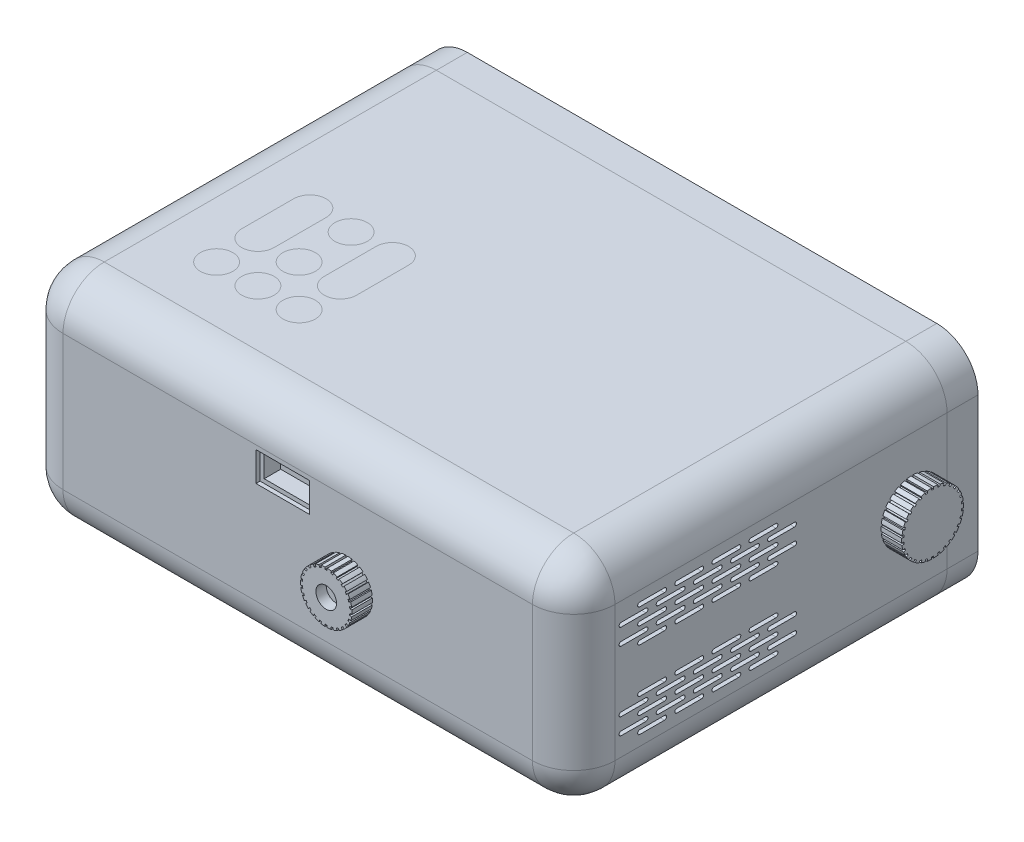
from build123d import *

# Parameters (mm, degrees)
SKETCH1_W               = 169.926
SKETCH1_H               = 124.46
BOSS_EXTRUDE1_DEPTH     = 67.056
FILLET1_R               = 12.7
SKETCH2_R               = 9.525
BOSS_EXTRUDE2_DEPTH     = 6.35
CUT_EXTRUDE1_DEPTH      = 6.35
SKETCH5_R               = 7.9375
BOSS_EXTRUDE3_DEPTH     = 6.35
SKETCH6_R               = 3.175
CUT_EXTRUDE3_DEPTH      = 3.175
CUT_EXTRUDE4_DEPTH      = 174.048626706
CUT_EXTRUDE4_DEPTH_BACK = 6.35
SKETCH8_R               = 4.445
CUT_EXTRUDE5_DEPTH      = 6.35
FILLET2_R               = 1
CUT_EXTRUDE6_DEPTH      = 6.35
CUT_EXTRUDE7_DEPTH      = 9.525
BOSS_EXTRUDE4_DEPTH     = 9.525
BOSS_EXTRUDE5_DEPTH     = 9.525
SKETCH13_3_R            = 25.4
BOSS_EXTRUDE6_DEPTH     = 9.525
FILLET3_R               = 1
BOSS_EXTRUDE7_DEPTH     = 9.525
SKETCH15_R              = 22.225
SKETCH15_R_2            = 18.415
BOSS_EXTRUDE8_DEPTH     = 3.81
CHAMFER1_SIZE           = 1.27
SKETCH15_3_R            = 18.415
SKETCH15_3_R_2          = 13.335
BOSS_EXTRUDE9_DEPTH     = 2.54
SKETCH16_R              = 6.35
SKETCH16_R_2            = 5.08
BOSS_EXTRUDE10_DEPTH    = 2.54
SKETCH17_R              = 5.08
BOSS_EXTRUDE11_DEPTH    = 5.08
BOSS_EXTRUDE11_2_DEPTH  = 5.08
BOSS_EXTRUDE11_3_DEPTH  = 5.08
BOSS_EXTRUDE11_4_DEPTH  = 5.08
CUT_EXTRUDE8_START      = 5.08
SKETCH18_R              = 5.715
SKETCH18_R_2            = 4.445
CUT_EXTRUDE8_DEPTH      = 1.27
SKETCH19_R              = 5
CUT_EXTRUDE9_DEPTH      = 2.54
SKETCH20_R              = 5
BOSS_EXTRUDE12_DEPTH    = 2.54
BOSS_EXTRUDE12_2_DEPTH  = 2.54
BOSS_EXTRUDE12_3_DEPTH  = 2.54
BOSS_EXTRUDE12_4_DEPTH  = 2.54
BOSS_EXTRUDE12_5_DEPTH  = 2.54
BOSS_EXTRUDE12_6_DEPTH  = 2.54
BOSS_EXTRUDE12_7_DEPTH  = 2.54
SKETCH21_W              = 14
SKETCH21_H              = 6.5
CUT_EXTRUDE10_DEPTH     = 6.35
SKETCH22_W              = 16.54
SKETCH22_H              = 9.04
SKETCH22_W_2            = 14
SKETCH22_H_2            = 6.5
CUT_EXTRUDE11_DEPTH     = 1.27
SKETCH23_R              = 15.875
CUT_EXTRUDE12_DEPTH     = 1.5875
SKETCH23_2_R            = 15.875
BOSS_EXTRUDE13_DEPTH    = 1.5875


with BuildPart() as part:
    # Sketch1 → Boss-Extrude1 (new body)
    with BuildSketch(Plane(origin=(0, 0, 0), x_dir=(1, 0, 0), z_dir=(0, 1, 0))):
        Rectangle(SKETCH1_W, SKETCH1_H)
    extrude(amount=BOSS_EXTRUDE1_DEPTH)

    # Fillet1
    fillet1_edges = [part.edges().sort_by_distance(p)[0] for p in [
        (-84.963, 67.056, 0),
        (0, 67.056, 62.23),
        (84.963, 67.056, 0),
        (0, 0, 62.23),
        (-84.963, 0, 0),
        (84.963, 0, 0),
        (84.963, 33.528, 62.23),
        (-84.963, 33.528, 62.23),
    ]]
    fillet(fillet1_edges, radius=FILLET1_R)

    # Sketch3 → Cut-Extrude1 (cut)
    with BuildSketch(Plane(origin=(84.963, 0, 0), x_dir=(0, 0, -1), z_dir=(1, 0, 0))):
        with BuildLine():
            Line((-41.91, 51.181), (-34.29, 51.181))
            ThreePointArc((-34.29, 51.181), (-33.655, 50.546), (-34.29, 49.911))
            Line((-34.29, 49.911), (-41.91, 49.911))
            ThreePointArc((-41.91, 49.911), (-42.545, 50.546), (-41.91, 51.181))
        make_face()
        with BuildLine():
            Line((-30.48, 51.181), (-22.86, 51.181))
            ThreePointArc((-22.86, 51.181), (-22.225, 50.546), (-22.86, 49.911))
            Line((-22.86, 49.911), (-30.48, 49.911))
            ThreePointArc((-30.48, 49.911), (-31.115, 50.546), (-30.48, 51.181))
        make_face()
        with BuildLine():
            Line((-19.05, 51.181), (-11.43, 51.181))
            ThreePointArc((-11.43, 51.181), (-10.795, 50.546), (-11.43, 49.911))
            Line((-11.43, 49.911), (-19.05, 49.911))
            ThreePointArc((-19.05, 49.911), (-19.685, 50.546), (-19.05, 51.181))
        make_face()
        with BuildLine():
            Line((-7.62, 51.181), (0, 51.181))
            ThreePointArc((0, 51.181), (0.635, 50.546), (0, 49.911))
            Line((0, 49.911), (-7.62, 49.911))
            ThreePointArc((-7.62, 49.911), (-8.255, 50.546), (-7.62, 51.181))
        make_face()
        with BuildLine():
            Line((-47.625, 48.641), (-40.005, 48.641))
            ThreePointArc((-40.005, 48.641), (-39.37, 48.006), (-40.005, 47.371))
            Line((-40.005, 47.371), (-47.625, 47.371))
            ThreePointArc((-47.625, 47.371), (-48.26, 48.006), (-47.625, 48.641))
        make_face()
        with BuildLine():
            Line((-36.195, 48.641), (-28.575, 48.641))
            ThreePointArc((-28.575, 48.641), (-27.94, 48.006), (-28.575, 47.371))
            Line((-28.575, 47.371), (-36.195, 47.371))
            ThreePointArc((-36.195, 47.371), (-36.83, 48.006), (-36.195, 48.641))
        make_face()
        with BuildLine():
            Line((-24.765, 48.641), (-17.145, 48.641))
            ThreePointArc((-17.145, 48.641), (-16.51, 48.006), (-17.145, 47.371))
            Line((-17.145, 47.371), (-24.765, 47.371))
            ThreePointArc((-24.765, 47.371), (-25.4, 48.006), (-24.765, 48.641))
        make_face()
        with BuildLine():
            Line((-13.335, 48.641), (-5.715, 48.641))
            ThreePointArc((-5.715, 48.641), (-5.08, 48.006), (-5.715, 47.371))
            Line((-5.715, 47.371), (-13.335, 47.371))
            ThreePointArc((-13.335, 47.371), (-13.97, 48.006), (-13.335, 48.641))
        make_face()
        with BuildLine():
            Line((-1.905, 48.641), (5.715, 48.641))
            ThreePointArc((5.715, 48.641), (6.35, 48.006), (5.715, 47.371))
            Line((5.715, 47.371), (-1.905, 47.371))
            ThreePointArc((-1.905, 47.371), (-2.54, 48.006), (-1.905, 48.641))
        make_face()
        with BuildLine():
            Line((-41.91, 46.101), (-34.29, 46.101))
            ThreePointArc((-34.29, 46.101), (-33.655, 45.466), (-34.29, 44.831))
            Line((-34.29, 44.831), (-41.91, 44.831))
            ThreePointArc((-41.91, 44.831), (-42.545, 45.466), (-41.91, 46.101))
        make_face()
        with BuildLine():
            Line((-30.48, 46.101), (-22.86, 46.101))
            ThreePointArc((-22.86, 46.101), (-22.225, 45.466), (-22.86, 44.831))
            Line((-22.86, 44.831), (-30.48, 44.831))
            ThreePointArc((-30.48, 44.831), (-31.115, 45.466), (-30.48, 46.101))
        make_face()
        with BuildLine():
            Line((-19.05, 46.101), (-11.43, 46.101))
            ThreePointArc((-11.43, 46.101), (-10.795, 45.466), (-11.43, 44.831))
            Line((-11.43, 44.831), (-19.05, 44.831))
            ThreePointArc((-19.05, 44.831), (-19.685, 45.466), (-19.05, 46.101))
        make_face()
        with BuildLine():
            Line((-7.62, 46.101), (0, 46.101))
            ThreePointArc((0, 46.101), (0.635, 45.466), (0, 44.831))
            Line((0, 44.831), (-7.62, 44.831))
            ThreePointArc((-7.62, 44.831), (-8.255, 45.466), (-7.62, 46.101))
        make_face()
        with BuildLine():
            Line((-47.625, 43.561), (-40.005, 43.561))
            ThreePointArc((-40.005, 43.561), (-39.37, 42.926), (-40.005, 42.291))
            Line((-40.005, 42.291), (-47.625, 42.291))
            ThreePointArc((-47.625, 42.291), (-48.26, 42.926), (-47.625, 43.561))
        make_face()
        with BuildLine():
            Line((-36.195, 43.561), (-28.575, 43.561))
            ThreePointArc((-28.575, 43.561), (-27.94, 42.926), (-28.575, 42.291))
            Line((-28.575, 42.291), (-36.195, 42.291))
            ThreePointArc((-36.195, 42.291), (-36.83, 42.926), (-36.195, 43.561))
        make_face()
        with BuildLine():
            Line((-24.765, 43.561), (-17.145, 43.561))
            ThreePointArc((-17.145, 43.561), (-16.51, 42.926), (-17.145, 42.291))
            Line((-17.145, 42.291), (-24.765, 42.291))
            ThreePointArc((-24.765, 42.291), (-25.4, 42.926), (-24.765, 43.561))
        make_face()
        with BuildLine():
            Line((-13.335, 43.561), (-5.715, 43.561))
            ThreePointArc((-5.715, 43.561), (-5.08, 42.926), (-5.715, 42.291))
            Line((-5.715, 42.291), (-13.335, 42.291))
            ThreePointArc((-13.335, 42.291), (-13.97, 42.926), (-13.335, 43.561))
        make_face()
        with BuildLine():
            Line((-1.905, 43.561), (5.715, 43.561))
            ThreePointArc((5.715, 43.561), (6.35, 42.926), (5.715, 42.291))
            Line((5.715, 42.291), (-1.905, 42.291))
            ThreePointArc((-1.905, 42.291), (-2.54, 42.926), (-1.905, 43.561))
        make_face()
        with BuildLine():
            Line((-41.91, 41.021), (-34.29, 41.021))
            ThreePointArc((-34.29, 41.021), (-33.655, 40.386), (-34.29, 39.751))
            Line((-34.29, 39.751), (-41.91, 39.751))
            ThreePointArc((-41.91, 39.751), (-42.545, 40.386), (-41.91, 41.021))
        make_face()
        with BuildLine():
            Line((-30.48, 41.021), (-22.86, 41.021))
            ThreePointArc((-22.86, 41.021), (-22.225, 40.386), (-22.86, 39.751))
            Line((-22.86, 39.751), (-30.48, 39.751))
            ThreePointArc((-30.48, 39.751), (-31.115, 40.386), (-30.48, 41.021))
        make_face()
        with BuildLine():
            Line((-19.05, 41.021), (-11.43, 41.021))
            ThreePointArc((-11.43, 41.021), (-10.795, 40.386), (-11.43, 39.751))
            Line((-11.43, 39.751), (-19.05, 39.751))
            ThreePointArc((-19.05, 39.751), (-19.685, 40.386), (-19.05, 41.021))
        make_face()
        with BuildLine():
            Line((-7.62, 41.021), (0, 41.021))
            ThreePointArc((0, 41.021), (0.635, 40.386), (0, 39.751))
            Line((0, 39.751), (-7.62, 39.751))
            ThreePointArc((-7.62, 39.751), (-8.255, 40.386), (-7.62, 41.021))
        make_face()
        with BuildLine():
            Line((-41.91, 27.305), (-34.29, 27.305))
            ThreePointArc((-34.29, 27.305), (-33.655, 26.67), (-34.29, 26.035))
            Line((-34.29, 26.035), (-41.91, 26.035))
            ThreePointArc((-41.91, 26.035), (-42.545, 26.67), (-41.91, 27.305))
        make_face()
        with BuildLine():
            Line((-30.48, 27.305), (-22.86, 27.305))
            ThreePointArc((-22.86, 27.305), (-22.225, 26.67), (-22.86, 26.035))
            Line((-22.86, 26.035), (-30.48, 26.035))
            ThreePointArc((-30.48, 26.035), (-31.115, 26.67), (-30.48, 27.305))
        make_face()
        with BuildLine():
            Line((-19.05, 27.305), (-11.43, 27.305))
            ThreePointArc((-11.43, 27.305), (-10.795, 26.67), (-11.43, 26.035))
            Line((-11.43, 26.035), (-19.05, 26.035))
            ThreePointArc((-19.05, 26.035), (-19.685, 26.67), (-19.05, 27.305))
        make_face()
        with BuildLine():
            Line((-7.62, 27.305), (0, 27.305))
            ThreePointArc((0, 27.305), (0.635, 26.67), (0, 26.035))
            Line((0, 26.035), (-7.62, 26.035))
            ThreePointArc((-7.62, 26.035), (-8.255, 26.67), (-7.62, 27.305))
        make_face()
        with BuildLine():
            Line((-47.625, 24.765), (-40.005, 24.765))
            ThreePointArc((-40.005, 24.765), (-39.37, 24.13), (-40.005, 23.495))
            Line((-40.005, 23.495), (-47.625, 23.495))
            ThreePointArc((-47.625, 23.495), (-48.26, 24.13), (-47.625, 24.765))
        make_face()
        with BuildLine():
            Line((-36.195, 24.765), (-28.575, 24.765))
            ThreePointArc((-28.575, 24.765), (-27.94, 24.13), (-28.575, 23.495))
            Line((-28.575, 23.495), (-36.195, 23.495))
            ThreePointArc((-36.195, 23.495), (-36.83, 24.13), (-36.195, 24.765))
        make_face()
        with BuildLine():
            Line((-24.765, 24.765), (-17.145, 24.765))
            ThreePointArc((-17.145, 24.765), (-16.51, 24.13), (-17.145, 23.495))
            Line((-17.145, 23.495), (-24.765, 23.495))
            ThreePointArc((-24.765, 23.495), (-25.4, 24.13), (-24.765, 24.765))
        make_face()
        with BuildLine():
            Line((-13.335, 24.765), (-5.715, 24.765))
            ThreePointArc((-5.715, 24.765), (-5.08, 24.13), (-5.715, 23.495))
            Line((-5.715, 23.495), (-13.335, 23.495))
            ThreePointArc((-13.335, 23.495), (-13.97, 24.13), (-13.335, 24.765))
        make_face()
        with BuildLine():
            Line((-1.905, 24.765), (5.715, 24.765))
            ThreePointArc((5.715, 24.765), (6.35, 24.13), (5.715, 23.495))
            Line((5.715, 23.495), (-1.905, 23.495))
            ThreePointArc((-1.905, 23.495), (-2.54, 24.13), (-1.905, 24.765))
        make_face()
        with BuildLine():
            Line((-41.91, 22.225), (-34.29, 22.225))
            ThreePointArc((-34.29, 22.225), (-33.655, 21.59), (-34.29, 20.955))
            Line((-34.29, 20.955), (-41.91, 20.955))
            ThreePointArc((-41.91, 20.955), (-42.545, 21.59), (-41.91, 22.225))
        make_face()
        with BuildLine():
            Line((-30.48, 22.225), (-22.86, 22.225))
            ThreePointArc((-22.86, 22.225), (-22.225, 21.59), (-22.86, 20.955))
            Line((-22.86, 20.955), (-30.48, 20.955))
            ThreePointArc((-30.48, 20.955), (-31.115, 21.59), (-30.48, 22.225))
        make_face()
        with BuildLine():
            Line((-19.05, 22.225), (-11.43, 22.225))
            ThreePointArc((-11.43, 22.225), (-10.795, 21.59), (-11.43, 20.955))
            Line((-11.43, 20.955), (-19.05, 20.955))
            ThreePointArc((-19.05, 20.955), (-19.685, 21.59), (-19.05, 22.225))
        make_face()
        with BuildLine():
            Line((-7.62, 22.225), (0, 22.225))
            ThreePointArc((0, 22.225), (0.635, 21.59), (0, 20.955))
            Line((0, 20.955), (-7.62, 20.955))
            ThreePointArc((-7.62, 20.955), (-8.255, 21.59), (-7.62, 22.225))
        make_face()
        with BuildLine():
            Line((-47.625, 19.685), (-40.005, 19.685))
            ThreePointArc((-40.005, 19.685), (-39.37, 19.05), (-40.005, 18.415))
            Line((-40.005, 18.415), (-47.625, 18.415))
            ThreePointArc((-47.625, 18.415), (-48.26, 19.05), (-47.625, 19.685))
        make_face()
        with BuildLine():
            Line((-36.195, 19.685), (-28.575, 19.685))
            ThreePointArc((-28.575, 19.685), (-27.94, 19.05), (-28.575, 18.415))
            Line((-28.575, 18.415), (-36.195, 18.415))
            ThreePointArc((-36.195, 18.415), (-36.83, 19.05), (-36.195, 19.685))
        make_face()
        with BuildLine():
            Line((-24.765, 19.685), (-17.145, 19.685))
            ThreePointArc((-17.145, 19.685), (-16.51, 19.05), (-17.145, 18.415))
            Line((-17.145, 18.415), (-24.765, 18.415))
            ThreePointArc((-24.765, 18.415), (-25.4, 19.05), (-24.765, 19.685))
        make_face()
        with BuildLine():
            Line((-13.335, 19.685), (-5.715, 19.685))
            ThreePointArc((-5.715, 19.685), (-5.08, 19.05), (-5.715, 18.415))
            Line((-5.715, 18.415), (-13.335, 18.415))
            ThreePointArc((-13.335, 18.415), (-13.97, 19.05), (-13.335, 19.685))
        make_face()
        with BuildLine():
            Line((-1.905, 19.685), (5.715, 19.685))
            ThreePointArc((5.715, 19.685), (6.35, 19.05), (5.715, 18.415))
            Line((5.715, 18.415), (-1.905, 18.415))
            ThreePointArc((-1.905, 18.415), (-2.54, 19.05), (-1.905, 19.685))
        make_face()
        with BuildLine():
            Line((-41.91, 17.145), (-34.29, 17.145))
            ThreePointArc((-34.29, 17.145), (-33.655, 16.51), (-34.29, 15.875))
            Line((-34.29, 15.875), (-41.91, 15.875))
            ThreePointArc((-41.91, 15.875), (-42.545, 16.51), (-41.91, 17.145))
        make_face()
        with BuildLine():
            Line((-30.48, 17.145), (-22.86, 17.145))
            ThreePointArc((-22.86, 17.145), (-22.225, 16.51), (-22.86, 15.875))
            Line((-22.86, 15.875), (-30.48, 15.875))
            ThreePointArc((-30.48, 15.875), (-31.115, 16.51), (-30.48, 17.145))
        make_face()
        with BuildLine():
            Line((-19.05, 17.145), (-11.43, 17.145))
            ThreePointArc((-11.43, 17.145), (-10.795, 16.51), (-11.43, 15.875))
            Line((-11.43, 15.875), (-19.05, 15.875))
            ThreePointArc((-19.05, 15.875), (-19.685, 16.51), (-19.05, 17.145))
        make_face()
        with BuildLine():
            Line((-7.62, 17.145), (0, 17.145))
            ThreePointArc((0, 17.145), (0.635, 16.51), (0, 15.875))
            Line((0, 15.875), (-7.62, 15.875))
            ThreePointArc((-7.62, 15.875), (-8.255, 16.51), (-7.62, 17.145))
        make_face()
    extrude(amount=-CUT_EXTRUDE1_DEPTH, mode=Mode.SUBTRACT)

    # Sketch5 → Boss-Extrude3 (add)
    with BuildSketch(Plane.XY.offset(62.23)):
        with Locations(Location((15.113, 30.843062085, 0), (0, 0, 180))):
            Circle(SKETCH5_R)
    extrude(amount=BOSS_EXTRUDE3_DEPTH)

    # Sketch6 → Cut-Extrude3 (cut)
    with BuildSketch(Plane.XY.offset(68.58)):
        with Locations((15.113, 30.843062085)):
            Circle(SKETCH6_R)
    extrude(amount=-CUT_EXTRUDE3_DEPTH, mode=Mode.SUBTRACT)

    # Sketch7 → Cut-Extrude4 (cut, two sides: drawn at the far end of the back side and taken through both)
    with BuildSketch(Plane.XY.offset(68.58).offset(-CUT_EXTRUDE4_DEPTH_BACK)):
        with BuildLine():
            ThreePointArc((17.319321849, 38.467762088), (17.012568085, 38.54991276), (16.702773795, 38.619727535))
            Line((16.702773795, 38.619727535), (16.552328611, 38.00934743))
            Line((16.552328611, 38.00934743), (17.168876665, 37.857381983))
            Line((17.168876665, 37.857381983), (17.319321849, 38.467762088))
        make_face()
        with BuildLine():
            ThreePointArc((19.079920293, 37.718194784), (18.801740178, 37.871369288), (18.517655716, 38.013293999))
            Line((18.517655716, 38.013293999), (18.225508676, 37.456654319))
            Line((18.225508676, 37.456654319), (18.787773252, 37.161555105))
            Line((18.787773252, 37.161555105), (19.079920293, 37.718194784))
        make_face()
        with BuildLine():
            ThreePointArc((20.609975748, 36.569069758), (20.3765361, 36.784366148), (20.134671423, 36.990152646))
            Line((20.134671423, 36.990152646), (19.717801049, 36.519603267))
            Line((19.717801049, 36.519603267), (20.193105374, 36.098520379))
            Line((20.193105374, 36.098520379), (20.609975748, 36.569069758))
        make_face()
        with BuildLine():
            ThreePointArc((21.820566953, 35.087169979), (21.645434436, 35.352076012), (21.459845839, 35.609764734))
            Line((21.459845839, 35.609764734), (20.942479124, 35.252652275))
            Line((20.942479124, 35.252652275), (21.303200238, 34.73005752))
            Line((21.303200238, 34.73005752), (21.820566953, 35.087169979))
        make_face()
        with BuildLine():
            ThreePointArc((22.641338748, 33.358618076), (22.534691426, 33.657738375), (22.416164645, 33.95235339))
            Line((22.416164645, 33.95235339), (21.828369061, 33.729431929))
            Line((21.828369061, 33.729431929), (22.053543164, 33.135696615))
            Line((22.053543164, 33.135696615), (22.641338748, 33.358618076))
        make_face()
        with BuildLine():
            ThreePointArc((23.024590859, 31.483871202), (22.992626688, 31.799821984), (22.948050067, 32.114241337))
            Line((22.948050067, 32.114241337), (22.323986157, 32.03846626))
            Line((22.323986157, 32.03846626), (22.400526949, 31.408096125))
            Line((22.400526949, 31.408096125), (23.024590859, 31.483871202))
        make_face()
        with BuildLine():
            ThreePointArc((22.948050067, 29.571882832), (22.992626688, 29.886302185), (23.024590859, 30.202252967))
            Line((23.024590859, 30.202252967), (22.400526949, 30.278028045))
            Line((22.400526949, 30.278028045), (22.323986157, 29.647657909))
            Line((22.323986157, 29.647657909), (22.948050067, 29.571882832))
        make_face()
        with BuildLine():
            ThreePointArc((22.416164645, 27.733770779), (22.534691426, 28.028385794), (22.641338748, 28.327506093))
            Line((22.641338748, 28.327506093), (22.053543164, 28.550427554))
            Line((22.053543164, 28.550427554), (21.828369061, 27.95669224))
            Line((21.828369061, 27.95669224), (22.416164645, 27.733770779))
        make_face()
        with BuildLine():
            ThreePointArc((21.459845839, 26.076359435), (21.645434436, 26.334048157), (21.820566953, 26.59895419))
            Line((21.820566953, 26.59895419), (21.303200238, 26.956066649))
            Line((21.303200238, 26.956066649), (20.942479124, 26.433471894))
            Line((20.942479124, 26.433471894), (21.459845839, 26.076359435))
        make_face()
        with BuildLine():
            ThreePointArc((20.134671423, 24.695971523), (20.3765361, 24.901758021), (20.609975748, 25.117054411))
            Line((20.609975748, 25.117054411), (20.193105374, 25.58760379))
            Line((20.193105374, 25.58760379), (19.717801049, 25.166520902))
            Line((19.717801049, 25.166520902), (20.134671423, 24.695971523))
        make_face()
        with BuildLine():
            ThreePointArc((18.517655716, 23.67283017), (18.801740178, 23.814754881), (19.079920293, 23.967929385))
            Line((19.079920293, 23.967929385), (18.787773252, 24.524569064))
            Line((18.787773252, 24.524569064), (18.225508676, 24.22946985))
            Line((18.225508676, 24.22946985), (18.517655716, 23.67283017))
        make_face()
        with BuildLine():
            ThreePointArc((16.702773795, 23.066396634), (17.012568085, 23.136211409), (17.31932185, 23.218362081))
            Line((17.31932185, 23.218362081), (17.168876665, 23.828742186))
            Line((17.168876665, 23.828742186), (16.552328611, 23.676776739))
            Line((16.552328611, 23.676776739), (16.702773795, 23.066396634))
        make_face()
        with BuildLine():
            Line((14.7955, 23.540562085), (14.7955, 22.911914627))
            ThreePointArc((14.7955, 22.911914627), (15.113, 22.905562085), (15.4305, 22.911914627))
            Line((15.4305, 22.911914627), (15.4305, 23.540562085))
            Line((15.4305, 23.540562085), (14.7955, 23.540562085))
        make_face()
        with BuildLine():
            Line((13.057123335, 23.828742186), (12.906678151, 23.218362081))
            ThreePointArc((12.906678151, 23.218362081), (13.213431915, 23.136211409), (13.523226205, 23.066396634))
            Line((13.523226205, 23.066396634), (13.673671389, 23.676776739))
            Line((13.673671389, 23.676776739), (13.057123335, 23.828742186))
        make_face()
        with BuildLine():
            Line((11.438226748, 24.524569064), (11.146079707, 23.967929385))
            ThreePointArc((11.146079707, 23.967929385), (11.424259822, 23.814754881), (11.708344284, 23.67283017))
            Line((11.708344284, 23.67283017), (12.000491324, 24.22946985))
            Line((12.000491324, 24.22946985), (11.438226748, 24.524569064))
        make_face()
        with BuildLine():
            Line((10.032894626, 25.58760379), (9.616024252, 25.117054411))
            ThreePointArc((9.616024252, 25.117054411), (9.8494639, 24.901758021), (10.091328577, 24.695971523))
            Line((10.091328577, 24.695971523), (10.508198951, 25.166520902))
            Line((10.508198951, 25.166520902), (10.032894626, 25.58760379))
        make_face()
        with BuildLine():
            Line((8.922799762, 26.956066649), (8.405433047, 26.59895419))
            ThreePointArc((8.405433047, 26.59895419), (8.580565564, 26.334048157), (8.766154161, 26.076359435))
            Line((8.766154161, 26.076359435), (9.283520876, 26.433471894))
            Line((9.283520876, 26.433471894), (8.922799762, 26.956066649))
        make_face()
        with BuildLine():
            Line((8.172456836, 28.550427554), (7.584661252, 28.327506093))
            ThreePointArc((7.584661252, 28.327506093), (7.691308574, 28.028385794), (7.809835355, 27.733770779))
            Line((7.809835355, 27.733770779), (8.397630939, 27.95669224))
            Line((8.397630939, 27.95669224), (8.172456836, 28.550427554))
        make_face()
        with BuildLine():
            Line((7.825473051, 30.278028045), (7.201409141, 30.202252967))
            ThreePointArc((7.201409141, 30.202252967), (7.233373312, 29.886302185), (7.277949933, 29.571882832))
            Line((7.277949933, 29.571882832), (7.902013843, 29.647657909))
            Line((7.902013843, 29.647657909), (7.825473051, 30.278028045))
        make_face()
        with BuildLine():
            Line((7.902013843, 32.03846626), (7.277949933, 32.114241337))
            ThreePointArc((7.277949933, 32.114241337), (7.233373312, 31.799821984), (7.201409141, 31.483871202))
            Line((7.201409141, 31.483871202), (7.825473051, 31.408096125))
            Line((7.825473051, 31.408096125), (7.902013843, 32.03846626))
        make_face()
        with BuildLine():
            Line((8.397630939, 33.729431929), (7.809835355, 33.95235339))
            ThreePointArc((7.809835355, 33.95235339), (7.691308574, 33.657738375), (7.584661252, 33.358618076))
            Line((7.584661252, 33.358618076), (8.172456836, 33.135696615))
            Line((8.172456836, 33.135696615), (8.397630939, 33.729431929))
        make_face()
        with BuildLine():
            Line((9.283520876, 35.252652275), (8.766154161, 35.609764734))
            ThreePointArc((8.766154161, 35.609764734), (8.580565564, 35.352076012), (8.405433047, 35.087169979))
            Line((8.405433047, 35.087169979), (8.922799762, 34.73005752))
            Line((8.922799762, 34.73005752), (9.283520876, 35.252652275))
        make_face()
        with BuildLine():
            Line((10.508198951, 36.519603267), (10.091328577, 36.990152646))
            ThreePointArc((10.091328577, 36.990152646), (9.8494639, 36.784366148), (9.616024252, 36.569069758))
            Line((9.616024252, 36.569069758), (10.032894626, 36.098520379))
            Line((10.032894626, 36.098520379), (10.508198951, 36.519603267))
        make_face()
        with BuildLine():
            Line((12.000491324, 37.456654319), (11.708344284, 38.013293999))
            ThreePointArc((11.708344284, 38.013293999), (11.424259822, 37.871369288), (11.146079707, 37.718194784))
            Line((11.146079707, 37.718194784), (11.438226748, 37.161555105))
            Line((11.438226748, 37.161555105), (12.000491324, 37.456654319))
        make_face()
        with BuildLine():
            Line((13.673671389, 38.00934743), (13.523226205, 38.619727535))
            ThreePointArc((13.523226205, 38.619727535), (13.213431915, 38.54991276), (12.906678151, 38.467762088))
            Line((12.906678151, 38.467762088), (13.057123335, 37.857381983))
            Line((13.057123335, 37.857381983), (13.673671389, 38.00934743))
        make_face()
        with BuildLine():
            Line((14.7955, 38.145562085), (15.113, 38.145562085))
            Line((15.113, 38.145562085), (15.113, 38.780562085))
            ThreePointArc((15.113, 38.780562085), (14.954218228, 38.77897379), (14.7955, 38.774209543))
            Line((14.7955, 38.774209543), (14.7955, 38.145562085))
        make_face()
        with BuildLine():
            Line((15.113, 38.780562085), (15.113, 38.145562085))
            Line((15.113, 38.145562085), (15.4305, 38.145562085))
            Line((15.4305, 38.145562085), (15.4305, 38.774209543))
            ThreePointArc((15.4305, 38.774209543), (15.271781772, 38.77897379), (15.113, 38.780562085))
        make_face()
    extrude(amount=CUT_EXTRUDE4_DEPTH + CUT_EXTRUDE4_DEPTH_BACK, mode=Mode.SUBTRACT)

    # Sketch8 → Cut-Extrude5 (cut)
    with BuildSketch(Plane.ZY.offset(84.963)):
        Polygon((19.002059531, 41.736), (19.73, 39.736), (28.73, 39.736), (29.457940469, 41.736), (32.23, 41.736), (32.23, 46.736), (16.23, 46.736), (16.23, 41.736), align=None)
        with Locations((-11.43, 43.236)):
            Circle(SKETCH8_R)
        with Locations((1.27, 43.236)):
            Circle(SKETCH8_R)
        with BuildLine():
            Line((1.27, 15.24), (10.16, 15.24))
            ThreePointArc((10.16, 15.24), (13.97, 19.05), (10.16, 22.86))
            Line((10.16, 22.86), (1.27, 22.86))
            ThreePointArc((1.27, 22.86), (-2.54, 19.05), (1.27, 15.24))
        make_face()
    extrude(amount=-CUT_EXTRUDE5_DEPTH, mode=Mode.SUBTRACT)

    # Fillet2
    fillet2_edges = [part.edges().sort_by_distance(p)[0] for p in [
        (-81.788, 41.736, 29.457940469),
        (-81.788, 39.736, 28.73),
        (-81.788, 39.736, 19.73),
        (-81.788, 41.736, 19.002059531),
        (-81.788, 41.736, 16.23),
        (-81.788, 46.736, 16.23),
        (-81.788, 46.736, 32.23),
        (-81.788, 41.736, 32.23),
    ]]
    fillet(fillet2_edges, radius=FILLET2_R)

    # Sketch11 → Cut-Extrude7 (cut)
    with BuildSketch(Plane(origin=(0, 0, -62.23), x_dir=(-1, 0, 0), z_dir=(0, 0, -1))):
        with BuildLine():
            Line((-84.963, 54.356), (-84.963, 12.7))
            ThreePointArc((-84.963, 12.7), (-81.243256121, 3.719743879), (-72.263, 0))
            Line((-72.263, 0), (72.263, 0))
            ThreePointArc((72.263, 0), (81.243256121, 3.719743879), (84.963, 12.7))
            Line((84.963, 12.7), (84.963, 54.356))
            ThreePointArc((84.963, 54.356), (81.243256121, 63.336256121), (72.263, 67.056))
            Line((72.263, 67.056), (-72.263, 67.056))
            ThreePointArc((-72.263, 67.056), (-81.243256121, 63.336256121), (-84.963, 54.356))
        make_face()
    extrude(amount=-CUT_EXTRUDE7_DEPTH, mode=Mode.SUBTRACT)

    # Sketch16 → Boss-Extrude10 (add)
    # profile 1 of 4: a face of its own
    with BuildSketch(Plane.XZ):
        with Locations(Location((-59.563, -40.005, 0), (0, 0, 90))):
            Circle(SKETCH16_R)
        with Locations(Location((-59.563, -40.005, 0), (0, 0, 270))):
            Circle(SKETCH16_R_2, mode=Mode.SUBTRACT)
    # profile 2 of 4: a face of its own
    with BuildSketch(Plane.XZ):
        with Locations(Location((-59.563, 40.005, 0), (0, 0, 270))):
            Circle(SKETCH16_R)
        with Locations(Location((-59.563, 40.005, 0), (0, 0, 90))):
            Circle(SKETCH16_R_2, mode=Mode.SUBTRACT)
    # profile 3 of 4: a face of its own
    with BuildSketch(Plane.XZ):
        with Locations(Location((59.563, 40.005, 0), (0, 0, 270))):
            Circle(SKETCH16_R)
        with Locations(Location((59.563, 40.005, 0), (0, 0, 90))):
            Circle(SKETCH16_R_2, mode=Mode.SUBTRACT)
    # profile 4 of 4: a face of its own
    with BuildSketch(Plane.XZ):
        with Locations(Location((59.563, -40.005, 0), (0, 0, 90))):
            Circle(SKETCH16_R)
        with Locations(Location((59.563, -40.005, 0), (0, 0, 270))):
            Circle(SKETCH16_R_2, mode=Mode.SUBTRACT)
    extrude(amount=BOSS_EXTRUDE10_DEPTH)

    # Sketch18 → Cut-Extrude8 (cut)
    # profile 1 of 4: a face of its own
    with BuildSketch(Plane.ZY.offset(78.613).offset(CUT_EXTRUDE8_START)):
        with Locations((-11.43, 43.236)):
            Circle(SKETCH18_R)
        with Locations((-11.43, 43.236)):
            Circle(SKETCH18_R_2, mode=Mode.SUBTRACT)
    # profile 2 of 4: a face of its own
    with BuildSketch(Plane.ZY.offset(78.613).offset(CUT_EXTRUDE8_START)):
        with Locations((1.27, 43.236)):
            Circle(SKETCH18_R)
        with Locations((1.27, 43.236)):
            Circle(SKETCH18_R_2, mode=Mode.SUBTRACT)
    # profile 3 of 4: a face of its own
    with BuildSketch(Plane.ZY.offset(78.613).offset(CUT_EXTRUDE8_START)):
        with BuildLine():
            Line((14.96, 45.736), (14.96, 42.736))
            ThreePointArc((14.96, 42.736), (15.624867607, 41.130867607), (17.23, 40.466))
            Line((17.23, 40.466), (18.112795958, 40.466))
            Line((18.112795958, 40.466), (18.297105289, 39.959614275))
            ThreePointArc((18.297105289, 39.959614275), (19.128189028, 38.876524859), (20.430207538, 38.466))
            Line((20.430207538, 38.466), (28.029792462, 38.466))
            ThreePointArc((28.029792462, 38.466), (29.331810972, 38.876524859), (30.162894711, 39.959614275))
            Line((30.162894711, 39.959614275), (30.347204042, 40.466))
            Line((30.347204042, 40.466), (31.23, 40.466))
            ThreePointArc((31.23, 40.466), (32.835132393, 41.130867607), (33.5, 42.736))
            Line((33.5, 42.736), (33.5, 45.736))
            ThreePointArc((33.5, 45.736), (32.835132393, 47.341132393), (31.23, 48.006))
            Line((31.23, 48.006), (17.23, 48.006))
            ThreePointArc((17.23, 48.006), (15.624867607, 47.341132393), (14.96, 45.736))
        make_face()
        with BuildLine():
            Line((19.241544614, 41.078020143), (19.490514917, 40.393979857))
            ThreePointArc((19.490514917, 40.393979857), (19.856631102, 39.916847956), (20.430207538, 39.736))
            Line((20.430207538, 39.736), (28.029792462, 39.736))
            ThreePointArc((28.029792462, 39.736), (28.603368898, 39.916847956), (28.969485083, 40.393979857))
            Line((28.969485083, 40.393979857), (29.218455386, 41.078020143))
            ThreePointArc((29.218455386, 41.078020143), (29.58457157, 41.555152044), (30.158148007, 41.736))
            Line((30.158148007, 41.736), (31.23, 41.736))
            ThreePointArc((31.23, 41.736), (31.937106781, 42.028893219), (32.23, 42.736))
            Line((32.23, 42.736), (32.23, 45.736))
            ThreePointArc((32.23, 45.736), (31.937106781, 46.443106781), (31.23, 46.736))
            Line((31.23, 46.736), (17.23, 46.736))
            ThreePointArc((17.23, 46.736), (16.522893219, 46.443106781), (16.23, 45.736))
            Line((16.23, 45.736), (16.23, 42.736))
            ThreePointArc((16.23, 42.736), (16.522893219, 42.028893219), (17.23, 41.736))
            Line((17.23, 41.736), (18.301851993, 41.736))
            ThreePointArc((18.301851993, 41.736), (18.87542843, 41.555152044), (19.241544614, 41.078020143))
        make_face(mode=Mode.SUBTRACT)
    # profile 4 of 4: a face of its own
    with BuildSketch(Plane.ZY.offset(78.613).offset(CUT_EXTRUDE8_START)):
        with BuildLine():
            Line((10.16, 24.13), (1.27, 24.13))
            ThreePointArc((1.27, 24.13), (-3.81, 19.05), (1.27, 13.97))
            Line((1.27, 13.97), (10.16, 13.97))
            ThreePointArc((10.16, 13.97), (15.24, 19.05), (10.16, 24.13))
        make_face()
        with BuildLine():
            Line((1.27, 15.24), (10.16, 15.24))
            ThreePointArc((10.16, 15.24), (13.97, 19.05), (10.16, 22.86))
            Line((10.16, 22.86), (1.27, 22.86))
            ThreePointArc((1.27, 22.86), (-2.54, 19.05), (1.27, 15.24))
        make_face(mode=Mode.SUBTRACT)
    extrude(amount=CUT_EXTRUDE8_DEPTH, mode=Mode.SUBTRACT)

    # Sketch19 → Cut-Extrude9 (cut)
    with BuildSketch(Plane(origin=(0, 67.056, 0), x_dir=(1, 0, 0), z_dir=(0, 1, 0))):
        with BuildLine():
            Line((-49.963, -19.53), (-49.963, -3.53))
            ThreePointArc((-49.963, -3.53), (-54.963, 1.47), (-59.963, -3.53))
            Line((-59.963, -3.53), (-59.963, -19.53))
            ThreePointArc((-59.963, -19.53), (-54.963, -24.53), (-49.963, -19.53))
        make_face()
        with Locations(Location((-42.263, -3.53, 0), (0, 0, 270))):
            Circle(SKETCH19_R)
        with Locations(Location((-42.263, -19.53, 0), (0, 0, 270))):
            Circle(SKETCH19_R)
        with BuildLine():
            Line((-24.563, -19.53), (-24.563, -3.53))
            ThreePointArc((-24.563, -3.53), (-29.563, 1.47), (-34.563, -3.53))
            Line((-34.563, -3.53), (-34.563, -19.53))
            ThreePointArc((-34.563, -19.53), (-29.563, -24.53), (-24.563, -19.53))
        make_face()
        with Locations(Location((-29.563, -32.23, 0), (0, 0, 270))):
            Circle(SKETCH19_R)
        with Locations(Location((-42.263, -32.23, 0), (0, 0, 270))):
            Circle(SKETCH19_R)
        with Locations(Location((-54.963, -32.23, 0), (0, 0, 270))):
            Circle(SKETCH19_R)
    extrude(amount=-CUT_EXTRUDE9_DEPTH, mode=Mode.SUBTRACT)

    # Sketch21 → Cut-Extrude10 (cut)
    with BuildSketch(Plane.XY.offset(62.23)):
        with Locations((-4.587, 48.566)):
            Rectangle(SKETCH21_W, SKETCH21_H)
    extrude(amount=-CUT_EXTRUDE10_DEPTH, mode=Mode.SUBTRACT)

    # Sketch22 → Cut-Extrude11 (cut)
    with BuildSketch(Plane.XY.offset(62.23)):
        with Locations((-4.587, 48.566)):
            Rectangle(SKETCH22_W, SKETCH22_H)
        with Locations((-4.587, 48.566)):
            Rectangle(SKETCH22_W_2, SKETCH22_H_2, mode=Mode.SUBTRACT)
    extrude(amount=-CUT_EXTRUDE11_DEPTH, mode=Mode.SUBTRACT)

    # Sketch23 → Cut-Extrude12 (cut)
    with BuildSketch(Plane(origin=(0, 0, -52.705), x_dir=(-1, 0, 0), z_dir=(0, 0, -1))):
        with Locations((-46.863, 29.718)):
            Circle(SKETCH23_R)
    extrude(amount=-CUT_EXTRUDE12_DEPTH, mode=Mode.SUBTRACT)


with BuildPart() as body_2:
    # Sketch2 → Boss-Extrude2 (new body)
    with BuildSketch(Plane(origin=(84.963, 0, 0), x_dir=(0, 0, -1), z_dir=(1, 0, 0))):
        with Locations((41.91, 33.528)):
            Circle(SKETCH2_R)
    extrude(amount=BOSS_EXTRUDE2_DEPTH)

    # Sketch10 → Cut-Extrude6 (cut)
    with BuildSketch(Plane(origin=(91.313, 0, 0), x_dir=(0, 0, -1), z_dir=(1, 0, 0))):
        with BuildLine():
            Line((40.372226932, 42.289744132), (40.241303513, 42.905690389))
            ThreePointArc((40.241303513, 42.905690389), (39.929641145, 42.844855897), (39.620179787, 42.773666466))
            Line((39.620179787, 42.773666466), (39.751103205, 42.157720209))
            Line((39.751103205, 42.157720209), (40.372226932, 42.289744132))
        make_face()
        with BuildLine():
            Line((38.584161926, 41.778558003), (38.32803707, 42.353823847))
            ThreePointArc((38.32803707, 42.353823847), (38.035833475, 42.229520484), (37.747935705, 42.095546078))
            Line((37.747935705, 42.095546078), (38.00406056, 41.520280234))
            Line((38.00406056, 41.520280234), (38.584161926, 41.778558003))
        make_face()
        with BuildLine():
            Line((36.941452003, 40.906782898), (36.571319596, 41.416226451))
            ThreePointArc((36.571319596, 41.416226451), (36.311345472, 41.233886871), (36.057593804, 41.042982816))
            Line((36.057593804, 41.042982816), (36.427726211, 40.533539262))
            Line((36.427726211, 40.533539262), (36.941452003, 40.906782898))
        make_face()
        with BuildLine():
            Line((35.515891469, 39.712519573), (35.047928073, 40.133875707))
            ThreePointArc((35.047928073, 40.133875707), (34.831545537, 39.901469026), (34.623030137, 39.661978743))
            Line((34.623030137, 39.661978743), (35.090993534, 39.240622608))
            Line((35.090993534, 39.240622608), (35.515891469, 39.712519573))
        make_face()
        with BuildLine():
            Line((34.36978416, 38.247963066), (33.82444202, 38.562816497))
            ThreePointArc((33.82444202, 38.562816497), (33.661108029, 38.2905), (33.50694202, 38.012890366))
            Line((33.50694202, 38.012890366), (34.05228416, 37.698036934))
            Line((34.05228416, 37.698036934), (34.36978416, 38.247963066))
        make_face()
        with BuildLine():
            Line((33.553220466, 36.577121524), (32.954333651, 36.771711646))
            ThreePointArc((32.954333651, 36.771711646), (32.851186682, 36.471386871), (32.758107859, 36.167790758))
            Line((32.758107859, 36.167790758), (33.356994674, 35.973200636))
            Line((33.356994674, 35.973200636), (33.553220466, 36.577121524))
        make_face()
        with BuildLine():
            Line((33.101888137, 34.77301874), (32.475630875, 34.838841031))
            ThreePointArc((32.475630875, 34.838841031), (32.437178947, 34.523633613), (32.409255301, 34.207319627))
            Line((32.409255301, 34.207319627), (33.035512563, 34.141497337))
            Line((33.035512563, 34.141497337), (33.101888137, 34.77301874))
        make_face()
        with BuildLine():
            Line((33.035512563, 32.914502663), (32.409255301, 32.848680373))
            ThreePointArc((32.409255301, 32.848680373), (32.437178947, 32.532366387), (32.475630875, 32.217158969))
            Line((32.475630875, 32.217158969), (33.101888137, 32.28298126))
            Line((33.101888137, 32.28298126), (33.035512563, 32.914502663))
        make_face()
        with BuildLine():
            Line((33.356994674, 31.082799364), (32.758107859, 30.888209242))
            ThreePointArc((32.758107859, 30.888209242), (32.851186682, 30.584613129), (32.954333651, 30.284288354))
            Line((32.954333651, 30.284288354), (33.553220466, 30.478878476))
            Line((33.553220466, 30.478878476), (33.356994674, 31.082799364))
        make_face()
        with BuildLine():
            Line((34.05228416, 29.357963066), (33.50694202, 29.043109634))
            ThreePointArc((33.50694202, 29.043109634), (33.661108029, 28.7655), (33.82444202, 28.493183503))
            Line((33.82444202, 28.493183503), (34.36978416, 28.808036934))
            Line((34.36978416, 28.808036934), (34.05228416, 29.357963066))
        make_face()
        with BuildLine():
            Line((35.090993534, 27.815377392), (34.623030137, 27.394021257))
            ThreePointArc((34.623030137, 27.394021257), (34.831545537, 27.154530974), (35.047928073, 26.922124293))
            Line((35.047928073, 26.922124293), (35.515891469, 27.343480427))
            Line((35.515891469, 27.343480427), (35.090993534, 27.815377392))
        make_face()
        with BuildLine():
            Line((36.427726211, 26.522460738), (36.057593804, 26.013017184))
            ThreePointArc((36.057593804, 26.013017184), (36.311345472, 25.822113129), (36.571319596, 25.639773549))
            Line((36.571319596, 25.639773549), (36.941452003, 26.149217102))
            Line((36.941452003, 26.149217102), (36.427726211, 26.522460738))
        make_face()
        with BuildLine():
            Line((38.00406056, 25.535719766), (37.747935705, 24.960453922))
            ThreePointArc((37.747935705, 24.960453922), (38.035833475, 24.826479516), (38.32803707, 24.702176153))
            Line((38.32803707, 24.702176153), (38.584161926, 25.277441997))
            Line((38.584161926, 25.277441997), (38.00406056, 25.535719766))
        make_face()
        with BuildLine():
            Line((39.751103205, 24.898279791), (39.620179787, 24.282333534))
            ThreePointArc((39.620179787, 24.282333534), (39.929641145, 24.211144103), (40.241303513, 24.150309611))
            Line((40.241303513, 24.150309611), (40.372226932, 24.766255868))
            Line((40.372226932, 24.766255868), (39.751103205, 24.898279791))
        make_face()
        with BuildLine():
            Line((41.5925, 24.638), (41.5925, 24.008293137))
            ThreePointArc((41.5925, 24.008293137), (41.91, 24.003), (42.2275, 24.008293137))
            Line((42.2275, 24.008293137), (42.2275, 24.638))
            Line((42.2275, 24.638), (41.5925, 24.638))
        make_face()
        with BuildLine():
            ThreePointArc((43.578696487, 24.150309611), (43.890358855, 24.211144103), (44.199820213, 24.282333534))
            Line((44.199820213, 24.282333534), (44.068896795, 24.898279791))
            Line((44.068896795, 24.898279791), (43.447773068, 24.766255868))
            Line((43.447773068, 24.766255868), (43.578696487, 24.150309611))
        make_face()
        with BuildLine():
            ThreePointArc((45.49196293, 24.702176153), (45.784166525, 24.826479516), (46.072064295, 24.960453922))
            Line((46.072064295, 24.960453922), (45.81593944, 25.535719766))
            Line((45.81593944, 25.535719766), (45.235838074, 25.277441997))
            Line((45.235838074, 25.277441997), (45.49196293, 24.702176153))
        make_face()
        with BuildLine():
            ThreePointArc((47.248680404, 25.639773549), (47.508654528, 25.822113129), (47.762406196, 26.013017184))
            Line((47.762406196, 26.013017184), (47.392273789, 26.522460738))
            Line((47.392273789, 26.522460738), (46.878547997, 26.149217102))
            Line((46.878547997, 26.149217102), (47.248680404, 25.639773549))
        make_face()
        with BuildLine():
            ThreePointArc((48.772071927, 26.922124293), (48.988454463, 27.154530974), (49.196969863, 27.394021257))
            Line((49.196969863, 27.394021257), (48.729006466, 27.815377392))
            Line((48.729006466, 27.815377392), (48.304108531, 27.343480427))
            Line((48.304108531, 27.343480427), (48.772071927, 26.922124293))
        make_face()
        with BuildLine():
            ThreePointArc((49.99555798, 28.493183503), (50.158891971, 28.7655), (50.31305798, 29.043109634))
            Line((50.31305798, 29.043109634), (49.76771584, 29.357963066))
            Line((49.76771584, 29.357963066), (49.45021584, 28.808036934))
            Line((49.45021584, 28.808036934), (49.99555798, 28.493183503))
        make_face()
        with BuildLine():
            ThreePointArc((50.865666349, 30.284288354), (50.968813318, 30.584613129), (51.061892141, 30.888209242))
            Line((51.061892141, 30.888209242), (50.463005326, 31.082799364))
            Line((50.463005326, 31.082799364), (50.266779534, 30.478878476))
            Line((50.266779534, 30.478878476), (50.865666349, 30.284288354))
        make_face()
        with BuildLine():
            ThreePointArc((51.344369125, 32.217158969), (51.382821053, 32.532366387), (51.410744699, 32.848680373))
            Line((51.410744699, 32.848680373), (50.784487437, 32.914502663))
            Line((50.784487437, 32.914502663), (50.718111863, 32.28298126))
            Line((50.718111863, 32.28298126), (51.344369125, 32.217158969))
        make_face()
        with BuildLine():
            ThreePointArc((51.410744699, 34.207319627), (51.382821053, 34.523633613), (51.344369125, 34.838841031))
            Line((51.344369125, 34.838841031), (50.718111863, 34.77301874))
            Line((50.718111863, 34.77301874), (50.784487437, 34.141497337))
            Line((50.784487437, 34.141497337), (51.410744699, 34.207319627))
        make_face()
        with BuildLine():
            ThreePointArc((51.061892141, 36.167790758), (50.968813318, 36.471386871), (50.865666349, 36.771711646))
            Line((50.865666349, 36.771711646), (50.266779534, 36.577121524))
            Line((50.266779534, 36.577121524), (50.463005326, 35.973200636))
            Line((50.463005326, 35.973200636), (51.061892141, 36.167790758))
        make_face()
        with BuildLine():
            Line((41.5925, 42.418), (41.91, 42.418))
            Line((41.91, 42.418), (41.91, 43.053))
            ThreePointArc((41.91, 43.053), (41.751227941, 43.051676624), (41.5925, 43.047706863))
            Line((41.5925, 43.047706863), (41.5925, 42.418))
        make_face()
        with BuildLine():
            Line((41.91, 43.053), (41.91, 42.418))
            Line((41.91, 42.418), (42.2275, 42.418))
            Line((42.2275, 42.418), (42.2275, 43.047706863))
            ThreePointArc((42.2275, 43.047706863), (42.068772059, 43.051676624), (41.91, 43.053))
        make_face()
        with BuildLine():
            ThreePointArc((44.199820213, 42.773666466), (43.890358855, 42.844855897), (43.578696487, 42.905690389))
            Line((43.578696487, 42.905690389), (43.447773068, 42.289744132))
            Line((43.447773068, 42.289744132), (44.068896795, 42.157720209))
            Line((44.068896795, 42.157720209), (44.199820213, 42.773666466))
        make_face()
        with BuildLine():
            ThreePointArc((46.072064295, 42.095546078), (45.784166525, 42.229520484), (45.49196293, 42.353823847))
            Line((45.49196293, 42.353823847), (45.235838074, 41.778558003))
            Line((45.235838074, 41.778558003), (45.81593944, 41.520280234))
            Line((45.81593944, 41.520280234), (46.072064295, 42.095546078))
        make_face()
        with BuildLine():
            ThreePointArc((47.762406196, 41.042982816), (47.508654528, 41.233886871), (47.248680404, 41.416226451))
            Line((47.248680404, 41.416226451), (46.878547997, 40.906782898))
            Line((46.878547997, 40.906782898), (47.392273789, 40.533539262))
            Line((47.392273789, 40.533539262), (47.762406196, 41.042982816))
        make_face()
        with BuildLine():
            ThreePointArc((49.196969863, 39.661978743), (48.988454463, 39.901469026), (48.772071927, 40.133875707))
            Line((48.772071927, 40.133875707), (48.304108531, 39.712519573))
            Line((48.304108531, 39.712519573), (48.729006466, 39.240622608))
            Line((48.729006466, 39.240622608), (49.196969863, 39.661978743))
        make_face()
        with BuildLine():
            ThreePointArc((50.31305798, 38.012890366), (50.158891971, 38.2905), (49.99555798, 38.562816497))
            Line((49.99555798, 38.562816497), (49.45021584, 38.247963066))
            Line((49.45021584, 38.247963066), (49.76771584, 37.698036934))
            Line((49.76771584, 37.698036934), (50.31305798, 38.012890366))
        make_face()
    extrude(amount=-CUT_EXTRUDE6_DEPTH, mode=Mode.SUBTRACT)


with BuildPart() as body_3:
    # Sketch12 → Boss-Extrude4 (new body)
    with BuildSketch(Plane(origin=(0, 0, -52.705), x_dir=(-1, 0, 0), z_dir=(0, 0, -1))):
        with BuildLine():
            ThreePointArc((-21.750375685, 33.528), (-46.863, 55.118), (-71.975624315, 33.528))
            Line((-71.975624315, 33.528), (-68.758993355, 33.528))
            ThreePointArc((-68.758993355, 33.528), (-46.863, 51.943), (-24.967006645, 33.528))
            Line((-24.967006645, 33.528), (-21.750375685, 33.528))
        make_face()
        with BuildLine():
            Line((-68.758993355, 33.528), (-71.975624315, 33.528))
            ThreePointArc((-71.975624315, 33.528), (-48.773411264, 4.389945815), (-21.463, 29.718))
            ThreePointArc((-21.463, 29.718), (-21.534945815, 31.628411264), (-21.750375685, 33.528))
            Line((-21.750375685, 33.528), (-24.967006645, 33.528))
            ThreePointArc((-24.967006645, 33.528), (-24.720404428, 31.630089523), (-24.638, 29.718))
            ThreePointArc((-24.638, 29.718), (-48.775089523, 7.575404428), (-68.758993355, 33.528))
        make_face()
    extrude(amount=BOSS_EXTRUDE4_DEPTH)


with BuildPart() as body_4:
    # Sketch13 → Boss-Extrude5 (new body)
    with BuildSketch(Plane(origin=(0, 0, -52.705), x_dir=(-1, 0, 0), z_dir=(0, 0, -1))):
        with BuildLine():
            Line((72.263, 67.056), (-72.263, 67.056))
            ThreePointArc((-72.263, 67.056), (-81.243256121, 63.336256121), (-84.963, 54.356))
            Line((-84.963, 54.356), (-84.963, 12.7))
            ThreePointArc((-84.963, 12.7), (-81.243256121, 3.719743879), (-72.263, 0))
            Line((-72.263, 0), (72.263, 0))
            ThreePointArc((72.263, 0), (81.243256121, 3.719743879), (84.963, 12.7))
            Line((84.963, 12.7), (84.963, 54.356))
            ThreePointArc((84.963, 54.356), (81.243256121, 63.336256121), (72.263, 67.056))
        make_face()
        with BuildLine():
            ThreePointArc((82.423, 54.356), (79.447204897, 61.540204897), (72.263, 64.516))
            Line((72.263, 64.516), (-72.263, 64.516))
            ThreePointArc((-72.263, 64.516), (-79.447204897, 61.540204897), (-82.423, 54.356))
            Line((-82.423, 54.356), (-82.423, 12.7))
            ThreePointArc((-82.423, 12.7), (-79.447204897, 5.515795103), (-72.263, 2.54))
            Line((-72.263, 2.54), (72.263, 2.54))
            ThreePointArc((72.263, 2.54), (79.447204897, 5.515795103), (82.423, 12.7))
            Line((82.423, 12.7), (82.423, 54.356))
        make_face(mode=Mode.SUBTRACT)
    extrude(amount=BOSS_EXTRUDE5_DEPTH)


with BuildPart() as body_5:
    # Sketch13<3> → Boss-Extrude6 (new body)
    with BuildSketch(Plane(origin=(0, 0, -52.705), x_dir=(-1, 0, 0), z_dir=(0, 0, -1))):
        with BuildLine():
            Line((-82.423, 54.356), (-82.423, 12.7))
            ThreePointArc((-82.423, 12.7), (-79.447204897, 5.515795103), (-72.263, 2.54))
            Line((-72.263, 2.54), (72.263, 2.54))
            ThreePointArc((72.263, 2.54), (79.447204897, 5.515795103), (82.423, 12.7))
            Line((82.423, 12.7), (82.423, 54.356))
            ThreePointArc((82.423, 54.356), (79.447204897, 61.540204897), (72.263, 64.516))
            Line((72.263, 64.516), (-72.263, 64.516))
            ThreePointArc((-72.263, 64.516), (-79.447204897, 61.540204897), (-82.423, 54.356))
        make_face()
        with Locations(Location((-46.863, 29.718, 0), (0, 0, 180))):
            Circle(SKETCH13_3_R, mode=Mode.SUBTRACT)
        with BuildLine():
            Line((57.023, 36.068), (65.913, 36.068))
            ThreePointArc((65.913, 36.068), (68.453, 33.528), (65.913, 30.988))
            Line((65.913, 30.988), (57.023, 30.988))
            ThreePointArc((57.023, 30.988), (54.483, 33.528), (57.023, 36.068))
        make_face(mode=Mode.SUBTRACT)
    extrude(amount=BOSS_EXTRUDE6_DEPTH)

    # Fillet3
    # the kernel refuses this fillet: 1 mm, written as the material it takes off along each edge
    with BuildSketch(Plane(origin=(-65.913, 30.988, -62.23), x_dir=(0, 0, 1), z_dir=(1, 0, 0)), Plane(origin=(-57.023, 36.068, -62.23), x_dir=(0, 0, 1), z_dir=(-1, 0, 0))) as fillet3_piece_1:
        with BuildLine():
            CenterArc((FILLET3_R, FILLET3_R), FILLET3_R, 180, 90)
            Line((0, FILLET3_R), (0, 0))
            Line((0, 0), (FILLET3_R, 0))
        make_face()
    extrude(amount=8.89, mode=Mode.SUBTRACT)
    with BuildSketch(Plane(origin=(-57.023, 33.528, -62.23), x_dir=(0, -1, 0), z_dir=(-1, 0, 0))) as fillet3_piece_2:
        with BuildLine():
            CenterArc((2.54 + FILLET3_R, FILLET3_R), FILLET3_R, 180, 90)
            Line((2.54 + FILLET3_R, 0), (2.54, 0))
            Line((2.54, 0), (2.54, FILLET3_R))
        make_face()
    revolve(axis=Axis((-57.023, 33.528, -62.23), (0, 0, 1)), revolution_arc=180, mode=Mode.SUBTRACT)
    with BuildSketch(Plane(origin=(-72.263, 12.7, -62.23), x_dir=(0, -1, 0), z_dir=(1, 0, 0))) as fillet3_piece_3:
        with BuildLine():
            CenterArc((10.16 - FILLET3_R, -FILLET3_R), FILLET3_R, 0, 90)
            Line((10.16 - FILLET3_R, 0), (10.16, 0))
            Line((10.16, 0), (10.16, -FILLET3_R))
        make_face()
    revolve(axis=Axis((-72.263, 12.7, -62.23), (0, 0, -1)), revolution_arc=90, mode=Mode.SUBTRACT)
    with BuildSketch(Plane(origin=(-82.423, 12.7, -62.23), x_dir=(0, 0, 1), z_dir=(0, 1, 0)), Plane(origin=(82.423, 54.356, -62.23), x_dir=(0, 0, 1), z_dir=(0, -1, 0))) as fillet3_piece_4:
        with BuildLine():
            CenterArc((FILLET3_R, FILLET3_R), FILLET3_R, 180, 90)
            Line((0, FILLET3_R), (0, 0))
            Line((0, 0), (FILLET3_R, 0))
        make_face()
    extrude(amount=41.656, mode=Mode.SUBTRACT)
    with BuildSketch(Plane(origin=(-72.263, 54.356, -62.23), x_dir=(-1, 0, 0), z_dir=(0, -1, 0))) as fillet3_piece_5:
        with BuildLine():
            CenterArc((10.16 - FILLET3_R, -FILLET3_R), FILLET3_R, 0, 90)
            Line((10.16 - FILLET3_R, 0), (10.16, 0))
            Line((10.16, 0), (10.16, -FILLET3_R))
        make_face()
    revolve(axis=Axis((-72.263, 54.356, -62.23), (0, 0, -1)), revolution_arc=90, mode=Mode.SUBTRACT)
    with BuildSketch(Plane(origin=(-72.263, 64.516, -62.23), x_dir=(0, 0, 1), z_dir=(1, 0, 0)), Plane(origin=(72.263, 2.54, -62.23), x_dir=(0, 0, 1), z_dir=(-1, 0, 0))) as fillet3_piece_6:
        with BuildLine():
            CenterArc((FILLET3_R, FILLET3_R), FILLET3_R, 180, 90)
            Line((0, FILLET3_R), (0, 0))
            Line((0, 0), (FILLET3_R, 0))
        make_face()
    extrude(amount=144.526, mode=Mode.SUBTRACT)
    with BuildSketch(Plane(origin=(72.263, 54.356, -62.23), x_dir=(0, 1, 0), z_dir=(-1, 0, 0))) as fillet3_piece_7:
        with BuildLine():
            CenterArc((10.16 - FILLET3_R, -FILLET3_R), FILLET3_R, 0, 90)
            Line((10.16 - FILLET3_R, 0), (10.16, 0))
            Line((10.16, 0), (10.16, -FILLET3_R))
        make_face()
    revolve(axis=Axis((72.263, 54.356, -62.23), (0, 0, -1)), revolution_arc=90, mode=Mode.SUBTRACT)
    with BuildSketch(Plane(origin=(72.263, 12.7, -62.23), x_dir=(1, 0, 0), z_dir=(0, 1, 0))) as fillet3_piece_8:
        with BuildLine():
            CenterArc((10.16 - FILLET3_R, -FILLET3_R), FILLET3_R, 0, 90)
            Line((10.16 - FILLET3_R, 0), (10.16, 0))
            Line((10.16, 0), (10.16, -FILLET3_R))
        make_face()
    revolve(axis=Axis((72.263, 12.7, -62.23), (0, 0, -1)), revolution_arc=90, mode=Mode.SUBTRACT)
    with BuildSketch(Plane(origin=(46.863, 29.718, -62.23), x_dir=(1, 0, 0), z_dir=(0, 1, 0))) as fillet3_piece_9:
        with BuildLine():
            CenterArc((25.4 + FILLET3_R, -FILLET3_R), FILLET3_R, 90, 90)
            Line((25.4 + FILLET3_R, 0), (25.4, 0))
            Line((25.4, 0), (25.4, -FILLET3_R))
        make_face()
    revolve(axis=Axis((46.863, 29.718, -62.23), (0, 0, -1)), mode=Mode.SUBTRACT)
    with BuildSketch(Plane(origin=(-65.913, 33.528, -62.23), x_dir=(0, 1, 0), z_dir=(1, 0, 0))) as fillet3_piece_10:
        with BuildLine():
            CenterArc((2.54 + FILLET3_R, FILLET3_R), FILLET3_R, 180, 90)
            Line((2.54 + FILLET3_R, 0), (2.54, 0))
            Line((2.54, 0), (2.54, FILLET3_R))
        make_face()
    revolve(axis=Axis((-65.913, 33.528, -62.23), (0, 0, 1)), revolution_arc=180, mode=Mode.SUBTRACT)


with BuildPart() as body_6:
    # Sketch14 → Boss-Extrude7 (new body)
    with BuildSketch(Plane(origin=(0, 0, -52.705), x_dir=(-1, 0, 0), z_dir=(0, 0, -1))):
        with BuildLine():
            Line((57.023, 30.988), (65.913, 30.988))
            ThreePointArc((65.913, 30.988), (68.453, 33.528), (65.913, 36.068))
            Line((65.913, 36.068), (57.023, 36.068))
            ThreePointArc((57.023, 36.068), (54.483, 33.528), (57.023, 30.988))
        make_face()
    extrude(amount=BOSS_EXTRUDE7_DEPTH)


with BuildPart() as body_7:
    # Sketch15 → Boss-Extrude8 (new body)
    with BuildSketch(Plane(origin=(0, 0, -52.705), x_dir=(-1, 0, 0), z_dir=(0, 0, -1))):
        with Locations(Location((-46.863, 29.718, 0), (0, 0, 180))):
            Circle(SKETCH15_R)
        with Locations(Location((-46.863, 29.718, 0), (0, 0, 180))):
            Circle(SKETCH15_R_2, mode=Mode.SUBTRACT)
    extrude(amount=BOSS_EXTRUDE8_DEPTH)

    # Chamfer1
    chamfer1_edges = [body_7.edges().sort_by_distance(p)[0] for p in [
        (28.448, 29.718, -56.515),
    ]]
    chamfer(chamfer1_edges, length=CHAMFER1_SIZE)


with BuildPart() as body_8:
    # Sketch15<3> → Boss-Extrude9 (new body)
    with BuildSketch(Plane(origin=(0, 0, -52.705), x_dir=(-1, 0, 0), z_dir=(0, 0, -1))):
        with Locations((-46.863, 29.718)):
            Circle(SKETCH15_3_R)
        with Locations((-46.863, 29.718)):
            Circle(SKETCH15_3_R_2, mode=Mode.SUBTRACT)
    extrude(amount=BOSS_EXTRUDE9_DEPTH)

    # Chamfer2: read off the stored shape, not the designer's step
    # Chamfer2 outline → Chamfer2 (revolve, cut)
    with BuildSketch(Plane(origin=(46.863, 29.718, 0), x_dir=(1, 0, 0), z_dir=(0, -1, 0))):
        Polygon((13.335, -55.245), (18.415, -55.245), (15.875, -52.705), (13.335, -52.705), align=None)
    revolve(axis=Axis((46.863, 29.718, 0), (0, 0, 1)), mode=Mode.SUBTRACT)


with BuildPart() as body_9:
    # Sketch17 → Boss-Extrude11 (new body)
    with BuildSketch(Plane.XZ):
        with Locations(Location((-59.563, -40.005, 0), (0, 0, 270))):
            Circle(SKETCH17_R)
    extrude(amount=BOSS_EXTRUDE11_DEPTH)


with BuildPart() as body_10:
    # Sketch17 → Boss-Extrude11 2 (new body)
    with BuildSketch(Plane.XZ):
        with Locations(Location((59.563, -40.005, 0), (0, 0, 270))):
            Circle(SKETCH17_R)
    extrude(amount=BOSS_EXTRUDE11_2_DEPTH)


with BuildPart() as body_11:
    # Sketch17 → Boss-Extrude11 3 (new body)
    with BuildSketch(Plane.XZ):
        with Locations(Location((59.563, 40.005, 0), (0, 0, 270))):
            Circle(SKETCH17_R)
    extrude(amount=BOSS_EXTRUDE11_3_DEPTH)


with BuildPart() as body_12:
    # Sketch17 → Boss-Extrude11 4 (new body)
    with BuildSketch(Plane.XZ):
        with Locations(Location((-59.563, 40.005, 0), (0, 0, 270))):
            Circle(SKETCH17_R)
    extrude(amount=BOSS_EXTRUDE11_4_DEPTH)


with BuildPart() as body_13:
    # Sketch20 → Boss-Extrude12 (new body)
    with BuildSketch(Plane(origin=(0, 64.516, 0), x_dir=(1, 0, 0), z_dir=(0, 1, 0))):
        with Locations(Location((-29.563, -32.23, 0), (0, 0, 270))):
            Circle(SKETCH20_R)
    extrude(amount=BOSS_EXTRUDE12_DEPTH)


with BuildPart() as body_14:
    # Sketch20 → Boss-Extrude12 2 (new body)
    with BuildSketch(Plane(origin=(0, 64.516, 0), x_dir=(1, 0, 0), z_dir=(0, 1, 0))):
        with Locations(Location((-54.963, -32.23, 0), (0, 0, 270))):
            Circle(SKETCH20_R)
    extrude(amount=BOSS_EXTRUDE12_2_DEPTH)


with BuildPart() as body_15:
    # Sketch20 → Boss-Extrude12 3 (new body)
    with BuildSketch(Plane(origin=(0, 64.516, 0), x_dir=(1, 0, 0), z_dir=(0, 1, 0))):
        with Locations(Location((-42.263, -32.23, 0), (0, 0, 270))):
            Circle(SKETCH20_R)
    extrude(amount=BOSS_EXTRUDE12_3_DEPTH)


with BuildPart() as body_16:
    # Sketch20 → Boss-Extrude12 4 (new body)
    with BuildSketch(Plane(origin=(0, 64.516, 0), x_dir=(1, 0, 0), z_dir=(0, 1, 0))):
        with Locations(Location((-42.263, -19.53, 0), (0, 0, 270))):
            Circle(SKETCH20_R)
    extrude(amount=BOSS_EXTRUDE12_4_DEPTH)


with BuildPart() as body_17:
    # Sketch20 → Boss-Extrude12 5 (new body)
    with BuildSketch(Plane(origin=(0, 64.516, 0), x_dir=(1, 0, 0), z_dir=(0, 1, 0))):
        with Locations(Location((-42.263, -3.53, 0), (0, 0, 270))):
            Circle(SKETCH20_R)
    extrude(amount=BOSS_EXTRUDE12_5_DEPTH)


with BuildPart() as body_18:
    # Sketch20 → Boss-Extrude12 6 (new body)
    with BuildSketch(Plane(origin=(0, 64.516, 0), x_dir=(1, 0, 0), z_dir=(0, 1, 0))):
        with BuildLine():
            Line((-49.963, -19.53), (-49.963, -3.53))
            ThreePointArc((-49.963, -3.53), (-54.963, 1.47), (-59.963, -3.53))
            Line((-59.963, -3.53), (-59.963, -19.53))
            ThreePointArc((-59.963, -19.53), (-54.963, -24.53), (-49.963, -19.53))
        make_face()
    extrude(amount=BOSS_EXTRUDE12_6_DEPTH)


with BuildPart() as body_19:
    # Sketch20 → Boss-Extrude12 7 (new body)
    with BuildSketch(Plane(origin=(0, 64.516, 0), x_dir=(1, 0, 0), z_dir=(0, 1, 0))):
        with BuildLine():
            Line((-24.563, -19.53), (-24.563, -3.53))
            ThreePointArc((-24.563, -3.53), (-29.563, 1.47), (-34.563, -3.53))
            Line((-34.563, -3.53), (-34.563, -19.53))
            ThreePointArc((-34.563, -19.53), (-29.563, -24.53), (-24.563, -19.53))
        make_face()
    extrude(amount=BOSS_EXTRUDE12_7_DEPTH)


with BuildPart() as body_20:
    # Sketch23<2> → Boss-Extrude13 (new body)
    with BuildSketch(Plane(origin=(0, 0, -52.705), x_dir=(-1, 0, 0), z_dir=(0, 0, -1))):
        with Locations((-46.863, 29.718)):
            Circle(SKETCH23_2_R)
    extrude(amount=-BOSS_EXTRUDE13_DEPTH)


solid = Compound([part.part, body_2.part, body_3.part, body_4.part, body_5.part, body_6.part, body_7.part, body_8.part, body_9.part, body_10.part, body_11.part, body_12.part, body_13.part, body_14.part, body_15.part, body_16.part, body_17.part, body_18.part, body_19.part, body_20.part])
